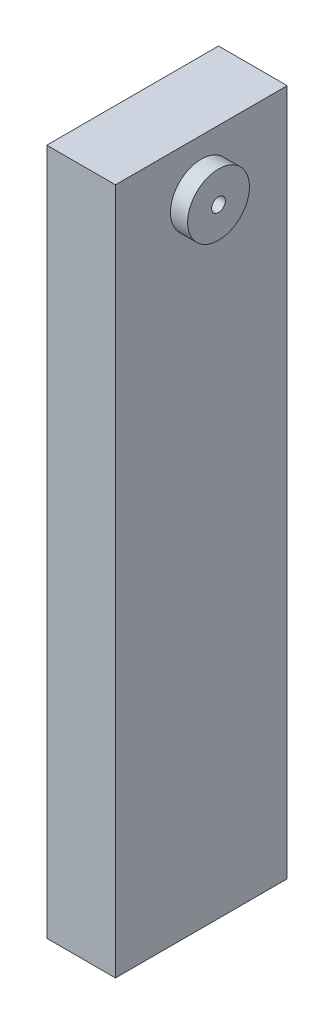
from build123d import *

# Parameters (mm, degrees)
SKETCH1_W           = 100
SKETCH1_H           = 250
BOSS_EXTRUDE1_DEPTH = 1000
SKETCH2_R           = 45
BOSS_EXTRUDE2_DEPTH = 25
SKETCH3_R           = 10
CUT_EXTRUDE1_DEPTH  = 25


with BuildPart() as part:
    # Sketch1 → Boss-Extrude1 (new body)
    with BuildSketch(Plane(origin=(0, 0, 0), x_dir=(1, 0, 0), z_dir=(0, 1, 0))):
        Rectangle(SKETCH1_W, SKETCH1_H)
    extrude(amount=BOSS_EXTRUDE1_DEPTH)

    # Sketch2 → Boss-Extrude2 (add)
    with BuildSketch(Plane(origin=(50, 0, 0), x_dir=(0, 0, -1), z_dir=(1, 0, 0))):
        with Locations((0, 925)):
            Circle(SKETCH2_R)
    extrude(amount=BOSS_EXTRUDE2_DEPTH)

    # Sketch3 → Cut-Extrude1 (cut)
    with BuildSketch(Plane(origin=(75, 0, 0), x_dir=(0, 0, -1), z_dir=(1, 0, 0))):
        with Locations((0, 925)):
            Circle(SKETCH3_R)
    extrude(amount=-CUT_EXTRUDE1_DEPTH, mode=Mode.SUBTRACT)


solid = part.part
